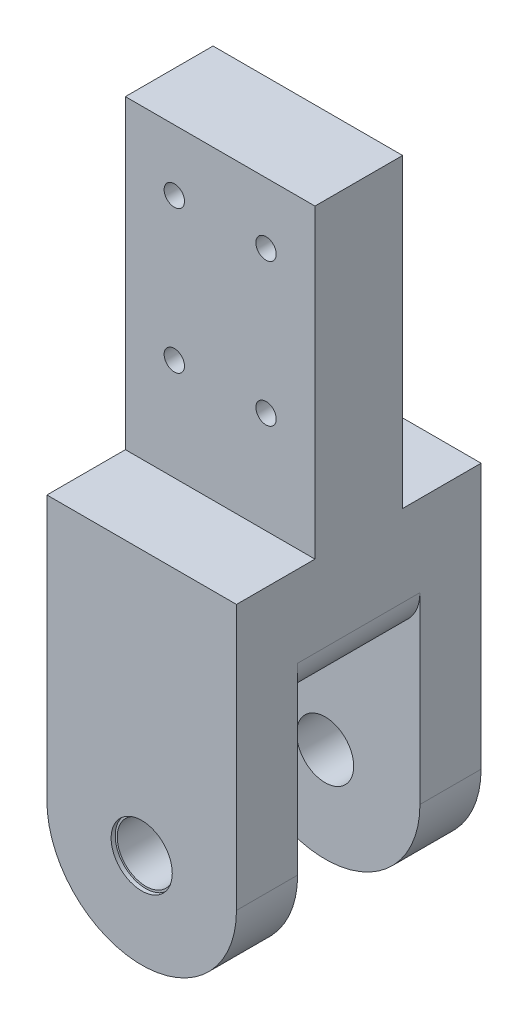
from build123d import *

# Parameters (mm, degrees)
SKETCH1_R           = 7
SKETCH1_R_2         = 2.5
BOSS_EXTRUDE1_DEPTH = 30
SKETCH2_W           = 30
SKETCH2_H           = 58.25
CUT_EXTRUDE1_DEPTH  = 151.539861831
SKETCH3_R           = 7.5
CUT_EXTRUDE2_DEPTH  = 1
CUT_EXTRUDE3_START  = -1
SKETCH4_R           = 7.5
CUT_EXTRUDE3_DEPTH  = 1
SKETCH6_W           = 17.3
SKETCH6_H           = 75
CUT_EXTRUDE4_DEPTH  = 151.539861831
SKETCH7_W           = 46.5
SKETCH7_H           = 1.95
CUT_EXTRUDE5_DEPTH  = 97.065732704
FILLET1_R           = 10


with BuildPart() as part:
    # Sketch1 → Boss-Extrude1 (new, symmetric)
    with BuildSketch(Plane.XY):
        with BuildLine():
            Line((-23.25, 0), (-23.25, 140))
            Line((-23.25, 140), (23.25, 140))
            Line((23.25, 140), (23.25, 0))
            ThreePointArc((23.25, 0), (0, -23.25), (-23.25, 0))
        make_face()
        Circle(SKETCH1_R, mode=Mode.SUBTRACT)
        with Locations((-11.25, 125)):
            Circle(SKETCH1_R_2, mode=Mode.SUBTRACT)
        with Locations((11.25, 125)):
            Circle(SKETCH1_R_2, mode=Mode.SUBTRACT)
        with Locations((11.25, 90)):
            Circle(SKETCH1_R_2, mode=Mode.SUBTRACT)
        with Locations((-11.25, 90)):
            Circle(SKETCH1_R_2, mode=Mode.SUBTRACT)
    extrude(amount=BOSS_EXTRUDE1_DEPTH, both=True)

    # Sketch2 → Cut-Extrude1 (cut, through all)
    with BuildSketch(Plane(origin=(23.25, 0, 0), x_dir=(0, 0, -1), z_dir=(1, 0, 0))):
        with Locations((0, 5.875)):
            Rectangle(SKETCH2_W, SKETCH2_H)
    extrude(amount=-CUT_EXTRUDE1_DEPTH, mode=Mode.SUBTRACT)

    # Sketch3 → Cut-Extrude2 (cut)
    with BuildSketch(Plane.XY.offset(30)):
        Circle(SKETCH3_R)
    extrude(amount=-CUT_EXTRUDE2_DEPTH, mode=Mode.SUBTRACT)

    # Sketch4 → Cut-Extrude3 (cut)
    with BuildSketch(Plane(origin=(0, 0, -30), x_dir=(-1, 0, 0), z_dir=(0, 0, -1)).offset(CUT_EXTRUDE3_START)):
        Circle(SKETCH4_R)
    extrude(amount=CUT_EXTRUDE3_DEPTH, mode=Mode.SUBTRACT)

    # Sketch6 → Cut-Extrude4 (cut, through all)
    with BuildSketch(Plane(origin=(23.25, 0, 0), x_dir=(0, 0, -1), z_dir=(1, 0, 0))):
        with Locations((-21.35, 102.5)):
            Rectangle(SKETCH6_W, SKETCH6_H)
        with Locations((21.35, 102.5)):
            Rectangle(SKETCH6_W, SKETCH6_H)
    extrude(amount=-CUT_EXTRUDE4_DEPTH, mode=Mode.SUBTRACT)

    # Sketch7 → Cut-Extrude5 (cut, through all)
    with BuildSketch(Plane(origin=(0, 65, 0), x_dir=(1, 0, 0), z_dir=(0, 1, 0))):
        with Locations((0, 11.725)):
            Rectangle(SKETCH7_W, SKETCH7_H)
        with Locations((0, -11.725)):
            Rectangle(SKETCH7_W, SKETCH7_H)
    extrude(amount=CUT_EXTRUDE5_DEPTH, mode=Mode.SUBTRACT)

    # Fillet1
    fillet1_edges = [part.edges().sort_by_distance(p)[0] for p in [
        (23.25, 35, 0),
        (-23.25, 35, 0),
    ]]
    fillet(fillet1_edges, radius=FILLET1_R)


solid = part.part
